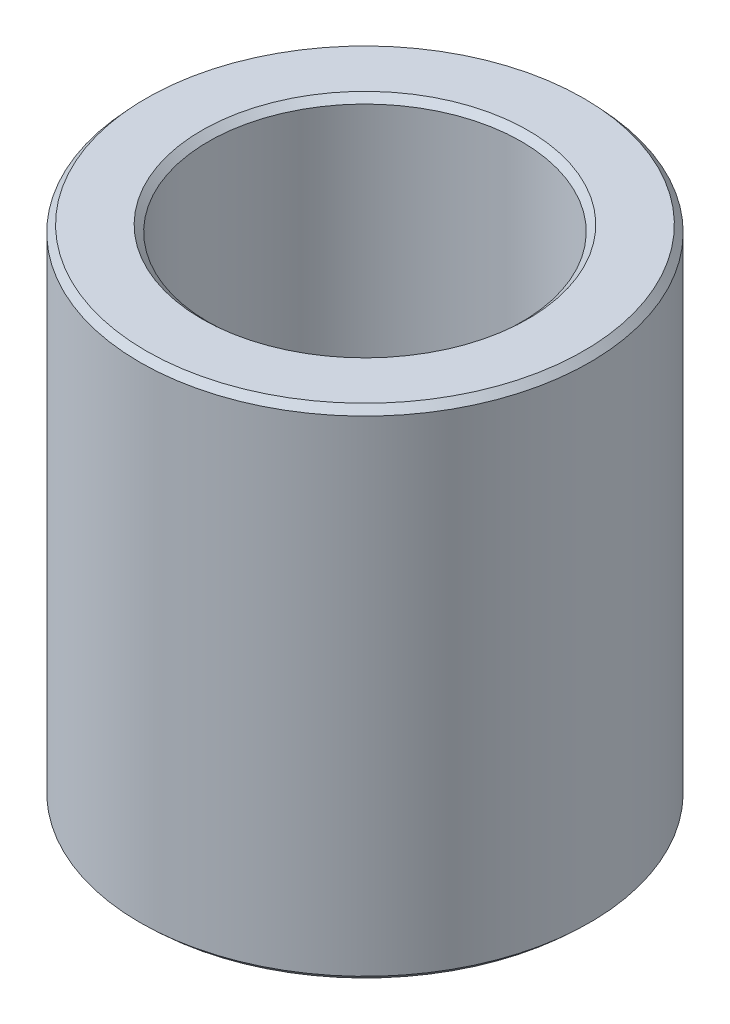
from build123d import *
from OCP.BRepFilletAPI import BRepFilletAPI_MakeChamfer

# Parameters (mm, degrees)
SKETCH1_R           = 22.5
BOSS_EXTRUDE1_DEPTH = 49.806899167
SKETCH2_R           = 15.646251672
CUT_EXTRUDE1_DEPTH  = 60.103529545
CHAMFER1_SIZE       = 0.674485073
CHAMFER1_SIZE2      = 0.622797455


with BuildPart() as part:
    # Sketch1 → Boss-Extrude1 (new body)
    with BuildSketch(Plane(origin=(0, 0, 0), x_dir=(1, 0, 0), z_dir=(0, 1, 0))):
        Circle(SKETCH1_R)
    extrude(amount=BOSS_EXTRUDE1_DEPTH)

    # Sketch2 → Cut-Extrude1 (cut, through all)
    with BuildSketch(Plane(origin=(0, 0, 0), x_dir=(1, 0, 0), z_dir=(0, 1, 0))):
        Circle(SKETCH2_R)
    extrude(amount=CUT_EXTRUDE1_DEPTH, mode=Mode.SUBTRACT)

    # Chamfer1: one chamfer whose edges measure the first distance from different faces: ONE call of the kernel's chamfer builder (chamfer() names one face for all edges)
    chamfer1_edges_1 = [part.edges().sort_by_distance(p)[0] for p in [
        (-15.646251672, 49.806899167, 0),
    ]]
    chamfer1_side_1 = [part.faces().sort_by_distance(p)[0] for p in [
        (-21.863603897, 49.806899167, 0),
    ]]
    chamfer1_edges_2 = [part.edges().sort_by_distance(p)[0] for p in [
        (-15.646251672, 0, 0),
    ]]
    chamfer1_side_2 = [part.faces().sort_by_distance(p)[0] for p in [
        (-15.646251672, 24.903449583, 0),
    ]]
    chamfer1_edges_3 = [part.edges().sort_by_distance(p)[0] for p in [
        (-22.5, 0, 0),
    ]]
    chamfer1_side_3 = [part.faces().sort_by_distance(p)[0] for p in [
        (-21.863603897, 0, 0),
    ]]
    chamfer1_edges_4 = [part.edges().sort_by_distance(p)[0] for p in [
        (-22.5, 49.806899167, 0),
    ]]
    chamfer1_side_4 = [part.faces().sort_by_distance(p)[0] for p in [
        (-22.5, 24.903449583, 0),
    ]]
    chamfer1 = BRepFilletAPI_MakeChamfer(part.part.solid().wrapped)
    for e in chamfer1_edges_1:
        chamfer1.Add(CHAMFER1_SIZE, CHAMFER1_SIZE2, e.wrapped, chamfer1_side_1[0].wrapped)  # the first distance lies on this face
    for e in chamfer1_edges_2:
        chamfer1.Add(CHAMFER1_SIZE, CHAMFER1_SIZE2, e.wrapped, chamfer1_side_2[0].wrapped)  # the first distance lies on this face
    for e in chamfer1_edges_3:
        chamfer1.Add(CHAMFER1_SIZE, CHAMFER1_SIZE2, e.wrapped, chamfer1_side_3[0].wrapped)  # the first distance lies on this face
    for e in chamfer1_edges_4:
        chamfer1.Add(CHAMFER1_SIZE, CHAMFER1_SIZE2, e.wrapped, chamfer1_side_4[0].wrapped)  # the first distance lies on this face
    add(Compound.cast(chamfer1.Shape()), mode=Mode.REPLACE)


solid = part.part
